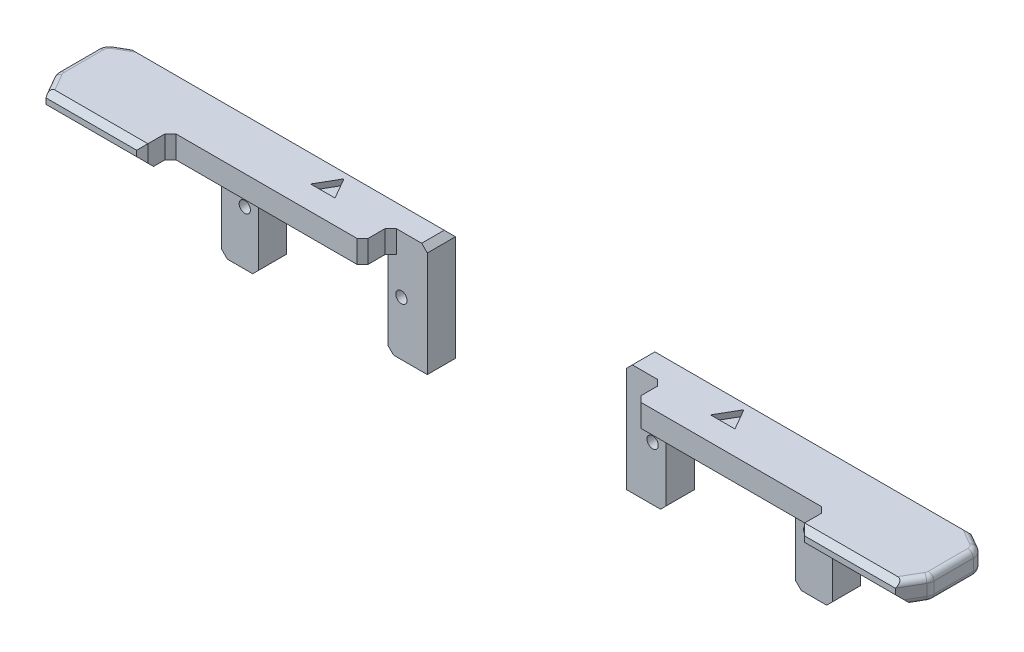
from build123d import *
from OCP.BRepFilletAPI import BRepFilletAPI_MakeChamfer

# Parameters (mm, degrees)
SKETCH1_W           = 36.5
SKETCH1_H           = 19.2
BOSS_EXTRUDE1_DEPTH = 5
SKETCH2_R           = 1
SKETCH2_W           = 23
SKETCH2_H           = 15.7
CUT_EXTRUDE3_DEPTH  = 67.428509309
SKETCH4_W           = 60
SKETCH4_H           = 15
BOSS_EXTRUDE2_DEPTH = 0.5
BOSS_EXTRUDE3_DEPTH = 3.5
CHAMFER1_SIZE       = 2
CHAMFER2_SIZE       = 1
CHAMFER3_SIZE       = 4
CHAMFER3_SIZE2      = 2.309401077
FILLET1_R           = 2
CUT_EXTRUDE4_DEPTH  = 1
FILLET2_R           = 1
CUT_EXTRUDE5_DEPTH  = 10
CHAMFER4_SIZE       = 1


with BuildPart() as part:
    # Sketch1 → Boss-Extrude1 (new body)
    with BuildSketch(Plane.XY):
        with Locations((-1.102631579, 53.75)):
            Rectangle(SKETCH1_W, SKETCH1_H)
    extrude(amount=BOSS_EXTRUDE1_DEPTH)

    # Sketch2 → Cut-Extrude3 (cut, through all)
    with BuildSketch(Plane.XY.offset(5)):
        with Locations((-15.252631579, 53.75)):
            Circle(SKETCH2_R)
        with Locations((12.547368421, 53.75)):
            Circle(SKETCH2_R)
        with Locations((-1.352631579, 52)):
            Rectangle(SKETCH2_W, SKETCH2_H)
    extrude(amount=-CUT_EXTRUDE3_DEPTH, mode=Mode.SUBTRACT)

    # Sketch4 → Boss-Extrude2 (add)
    with BuildSketch(Plane(origin=(0, 63.35, 0), x_dir=(1, 0, 0), z_dir=(0, 1, 0))):
        with Locations((-12.852631579, -7.5)):
            Rectangle(SKETCH4_W, SKETCH4_H)
    extrude(amount=BOSS_EXTRUDE2_DEPTH)

    # Sketch7 → Boss-Extrude3 (add)
    with BuildSketch(Plane.XZ.offset(-63.35)):
        Polygon((-19.352631579, 0), (-42.852631579, 0), (-42.852631579, 15), (-19.052631579, 15), (17.147368421, 15), (17.147368421, 5), (-19.352631579, 5), align=None)
    extrude(amount=BOSS_EXTRUDE3_DEPTH)

    # Chamfer1
    chamfer1_edges = [part.edges().sort_by_distance(p)[0] for p in [
        (-12.852631579, 59.85, 15),
    ]]
    chamfer(chamfer1_edges, length=CHAMFER1_SIZE)

    # Chamfer2
    chamfer2_edges = [part.edges().sort_by_distance(p)[0] for p in [
        (-12.852631579, 44.15, 2.5),
        (10.147368421, 44.15, 2.5),
        (17.147368421, 63.85, 7.5),
        (-12.852631579, 63.85, 0),
        (-12.852631579, 63.85, 15),
        (-19.352631579, 59.85, 2.5),
        (-19.352631579, 44.15, 2.5),
    ]]
    chamfer(chamfer2_edges, length=CHAMFER2_SIZE)

    # Chamfer3: one chamfer whose edges measure the first distance from different faces: ONE call of the kernel's chamfer builder (chamfer() names one face for all edges)
    chamfer3_edges_1 = [part.edges().sort_by_distance(p)[0] for p in [
        (-42.852631579, 61.35, 0),
    ]]
    chamfer3_side_1 = [part.faces().sort_by_distance(p)[0] for p in [
        (-18.724165987, 52, 0),
    ]]
    chamfer3_edges_2 = [part.edges().sort_by_distance(p)[0] for p in [
        (-42.852631579, 62.35, 15),
    ]]
    chamfer3_side_2 = [part.faces().sort_by_distance(p)[0] for p in [
        (-42.852631579, 61.86754386, 7.260233918),
    ]]
    chamfer3 = BRepFilletAPI_MakeChamfer(part.part.solid().wrapped)
    for e in chamfer3_edges_1:
        chamfer3.Add(CHAMFER3_SIZE, CHAMFER3_SIZE2, e.wrapped, chamfer3_side_1[0].wrapped)  # the first distance lies on this face
    for e in chamfer3_edges_2:
        chamfer3.Add(CHAMFER3_SIZE, CHAMFER3_SIZE2, e.wrapped, chamfer3_side_2[0].wrapped)  # the first distance lies on this face
    add(Compound.cast(chamfer3.Shape()), mode=Mode.REPLACE)

    # Fillet1
    fillet1_edges = [part.edges().sort_by_distance(p)[0] for p in [
        (-42.852631579, 61.85, 11),
        (-42.852631579, 61.85, 2.309401077),
    ]]
    fillet(fillet1_edges, radius=FILLET1_R)

    # Sketch8 → Cut-Extrude4 (cut)
    with BuildSketch(Plane(origin=(0, 63.85, 0), x_dir=(1, 0, 0), z_dir=(0, 1, 0))):
        Polygon((-0.652631579, -2), (-2.817695088, -5.75), (1.512431931, -5.75), align=None)
    extrude(amount=-CUT_EXTRUDE4_DEPTH, mode=Mode.SUBTRACT)

    # Fillet2
    fillet2_edges = [part.edges().sort_by_distance(p)[0] for p in [
        (-41.218656983, 63.85, 1.366025404),
        (-42.584682387, 63.85, 2.464101615),
        (-41.852631579, 63.85, 12.732050808),
        (-42.784483232, 63.85, 10.981739705),
        (-40.352631579, 59.85, 0.866025404),
        (-42.584682387, 59.85, 2.464101615),
        (-42.141306714, 59.85, 12.232050808),
        (-42.784483232, 59.85, 10.981739705),
        (-42.852631579, 63.85, 6.964101615),
        (-42.852631579, 59.85, 6.964101615),
    ]]
    fillet(fillet2_edges, radius=FILLET2_R - 0.0001)  # a hair under: the kernel refuses the full size

    # Sketch9 → Cut-Extrude5 (cut)
    with BuildSketch(Plane(origin=(0, 63.85, 0), x_dir=(1, 0, 0), z_dir=(0, 1, 0))):
        Polygon((17.147368421, -5), (10.647368421, -5), (10.647368421, -10), (-23.452631579, -10), (-23.452631579, -15), (9.647368421, -15), (17.147368421, -15), align=None)
    extrude(amount=-CUT_EXTRUDE5_DEPTH, mode=Mode.SUBTRACT)

    # Chamfer4
    chamfer4_edges = [part.edges().sort_by_distance(p)[0] for p in [
        (10.647368421, 61.85, 5),
        (-23.452631579, 61.85, 10),
        (10.647368421, 61.85, 10),
        (-23.452631579, 62.35, 15),
    ]]
    chamfer(chamfer4_edges, length=CHAMFER4_SIZE)


with BuildPart() as body_2:
    # Mirror1: mirrored copy
    add(part.part.mirror(Plane.ZY.offset(-34.84782876)))


solid = Compound([part.part, body_2.part])
